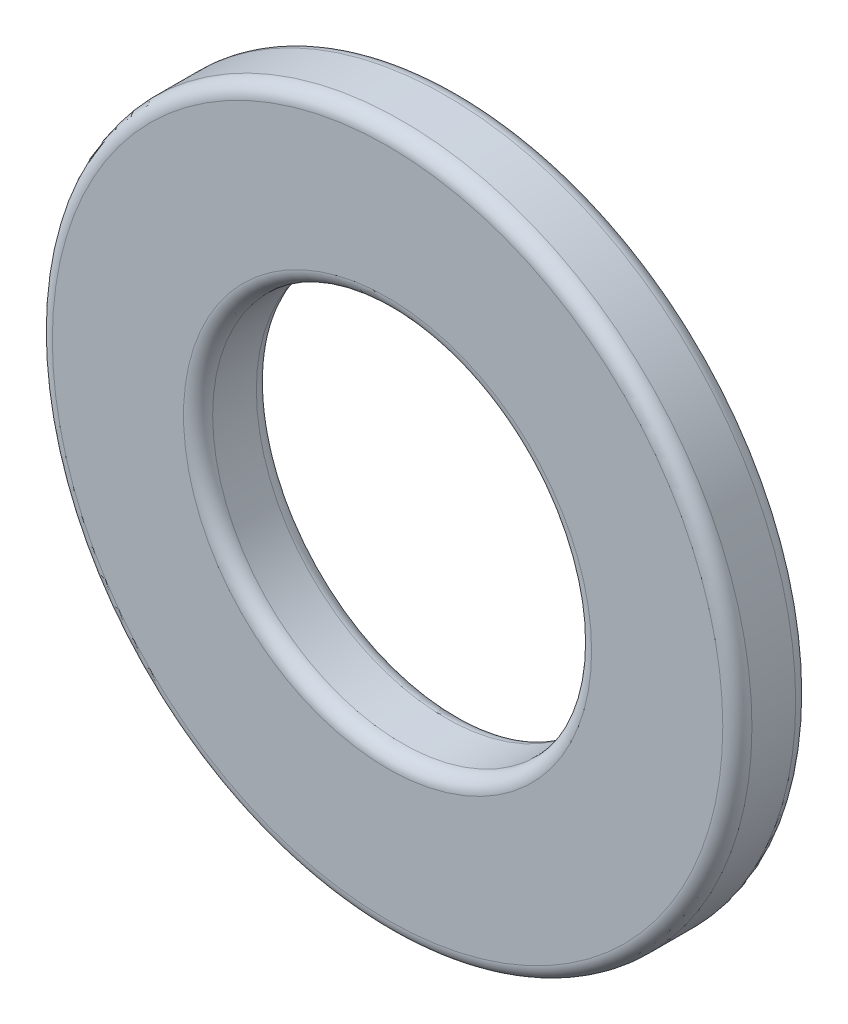
from build123d import *

# Parameters (mm, degrees)
SKETCH1_R           = 12
SKETCH1_R_2         = 6.5
BOSS_EXTRUDE1_DEPTH = 2.5
FILLET1_R           = 0.5


with BuildPart() as part:
    # Sketch1 → Boss-Extrude1 (new body)
    with BuildSketch(Plane.XY):
        Circle(SKETCH1_R)
        Circle(SKETCH1_R_2, mode=Mode.SUBTRACT)
    extrude(amount=BOSS_EXTRUDE1_DEPTH)

    # Fillet1
    fillet1_edges = [part.edges().sort_by_distance(p)[0] for p in [
        (-6.5, 0, 0),
        (-12, 0, 0),
        (-12, 0, 2.5),
        (-6.5, 0, 2.5),
    ]]
    fillet(fillet1_edges, radius=FILLET1_R)


solid = part.part
